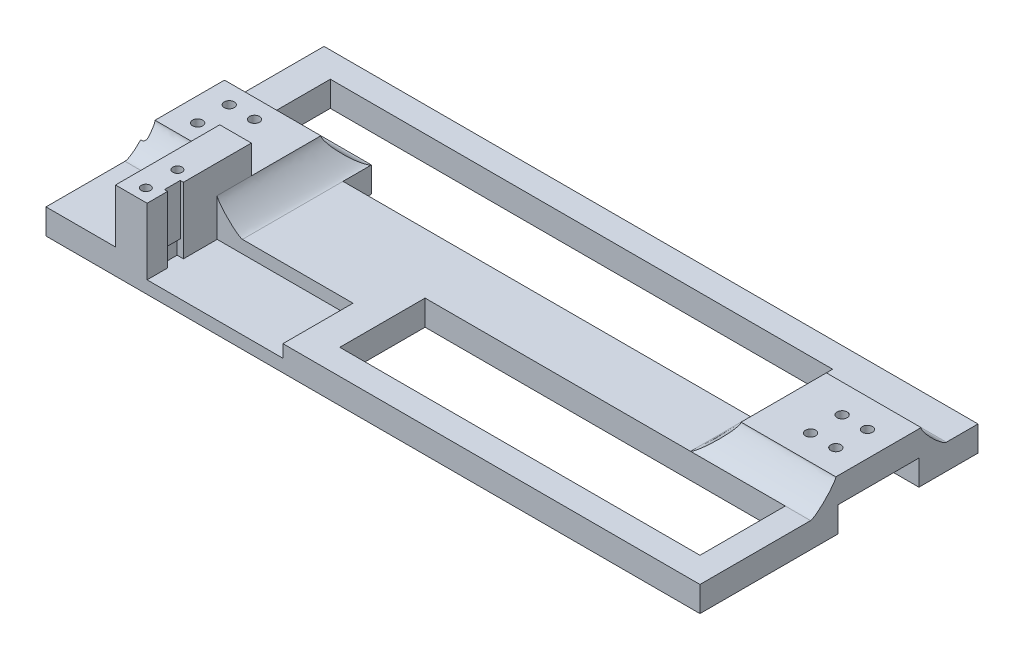
from build123d import *

# Parameters (mm, degrees)
SKETCH1_W            = 300
SKETCH1_H            = 20
BOSS_EXTRUDE1_DEPTH  = 8
SKETCH2_W            = 34
SKETCH2_H            = 8
BOSS_EXTRUDE2_DEPTH  = 9
SKETCH3_W            = 34
SKETCH3_H            = 8
BOSS_EXTRUDE3_DEPTH  = 9
SKETCH4_R            = 1.45
CUT_EXTRUDE1_DEPTH   = 302.504560496
SKETCH5_W            = 25
SKETCH5_H            = 8
BOSS_EXTRUDE4_DEPTH  = 17
SKETCH6_W            = 25
SKETCH6_H            = 8
BOSS_EXTRUDE5_DEPTH  = 17
SKETCH7_W            = 10
SKETCH7_H            = 38
CUT_EXTRUDE2_DEPTH   = 303.37890138
SKETCH8_W            = 7
SKETCH8_H            = 16
CUT_EXTRUDE3_DEPTH   = 4
CUT_EXTRUDE4_DEPTH   = 7
BOSS_EXTRUDE6_DEPTH  = 10
SKETCH12_W           = 8
SKETCH12_H           = 8
BOSS_EXTRUDE7_DEPTH  = 17
SKETCH13_R           = 1.7
CUT_EXTRUDE6_DEPTH   = 305.926220585
SKETCH14_W           = 20
SKETCH14_H           = 13
BOSS_EXTRUDE8_DEPTH  = 12
SKETCH15_R           = 1.6
CUT_EXTRUDE7_DEPTH   = 20
SKETCH16_W           = 20
SKETCH16_H           = 13
BOSS_EXTRUDE9_DEPTH  = 12
SKETCH17_R           = 1.6
CUT_EXTRUDE8_DEPTH   = 20
SKETCH18_W           = 20
SKETCH18_H           = 13
BOSS_EXTRUDE10_DEPTH = 12
CUT_EXTRUDE9_START   = -20
SKETCH19_R           = 1.6
CUT_EXTRUDE9_DEPTH   = 20
SKETCH20_W           = 20
SKETCH20_H           = 13
BOSS_EXTRUDE11_DEPTH = 12
CUT_EXTRUDE10_START  = -20
SKETCH21_R           = 1.6
CUT_EXTRUDE10_DEPTH  = 20
FILLET6_R            = 3
SKETCH22_W           = 114.514593174
SKETCH22_H           = 38.01155773
CUT_EXTRUDE11_DEPTH  = 59
SKETCH23_W           = 255.474860827
SKETCH23_H           = 73.711598505
CUT_EXTRUDE12_DEPTH  = 36
SKETCH24_W           = 30
SKETCH24_H           = 20
BOSS_EXTRUDE12_DEPTH = 8
SKETCH25_W           = 20
SKETCH25_H           = 8
CUT_EXTRUDE13_DEPTH  = 243.357174435
SKETCH26_R           = 1.6
CUT_EXTRUDE14_DEPTH  = 242.960740617
SKETCH27_W           = 30
SKETCH27_H           = 8
BOSS_EXTRUDE13_DEPTH = 15
SKETCH28_W           = 30
SKETCH28_H           = 26
BOSS_EXTRUDE14_DEPTH = 8
SKETCH29_W           = 21
SKETCH29_H           = 8
CUT_EXTRUDE17_DEPTH  = 25
SKETCH30_R           = 1.6
CUT_EXTRUDE18_DEPTH  = 242.960740617
SKETCH31_W           = 10
SKETCH31_H           = 8
BOSS_EXTRUDE15_DEPTH = 34
SKETCH32_W           = 10
SKETCH32_H           = 34
BOSS_EXTRUDE16_DEPTH = 17
SKETCH33_R           = 1.45
CUT_EXTRUDE19_DEPTH  = 249.237789226
SKETCH34_W           = 175
SKETCH34_H           = 34
SKETCH34_W_2         = 155
BOSS_EXTRUDE17_DEPTH = 8
SKETCH35_W           = 19
SKETCH35_H           = 8
BOSS_EXTRUDE23_DEPTH = 8
SKETCH36_W           = 30
SKETCH36_H           = 8
BOSS_EXTRUDE24_DEPTH = 1
SKETCH37_W           = 19
SKETCH37_H           = 8
BOSS_EXTRUDE25_DEPTH = 22
SKETCH38_W           = 30
SKETCH38_H           = 8
BOSS_EXTRUDE26_DEPTH = 1
SKETCH39_W           = 20
SKETCH39_H           = 8
BOSS_EXTRUDE27_DEPTH = 1
SKETCH49_W           = 10
SKETCH49_H           = 9
CUT_EXTRUDE25_DEPTH  = 1
SKETCH40_W           = 33.7
SKETCH40_H           = 8
BOSS_EXTRUDE28_DEPTH = 20
SKETCH41_W           = 114.01162948
SKETCH41_H           = 27
SKETCH41_W_2         = 34.98837052
SKETCH41_H_2         = 14.181402085
CUT_EXTRUDE20_DEPTH  = 248.560093715
SKETCH42_W           = 42.98837052
SKETCH42_H           = 22.181402085
BOSS_EXTRUDE29_DEPTH = 4
FILLET13_SIZE        = 8
SKETCH43_W           = 5
SKETCH43_H           = 21
CUT_EXTRUDE21_DEPTH  = 1
SKETCH44_W           = 5
SKETCH44_H           = 5
CUT_EXTRUDE22_DEPTH  = 1
SKETCH45_W           = 21
SKETCH45_H           = 0.3
CUT_EXTRUDE23_DEPTH  = 8
BOSS_EXTRUDE31_DEPTH = 2
FILLET14_START       = 34
FILLET14_DEPTH       = 31.9999999
FILLET14_START_2     = -9.0000001
FILLET14_2_DEPTH     = 8.0000001
FILLET14_START_3     = 65.99999999
FILLET14_3_DEPTH     = 8.00000011
SKETCH48_W           = 28
SKETCH48_H           = 23.779662164
CUT_EXTRUDE24_DEPTH  = 1.5
FILLET15_R           = 1


with BuildPart() as part:
    # Sketch1 → Boss-Extrude1 (new body)
    with BuildSketch(Plane(origin=(0, 0, 0), x_dir=(1, 0, 0), z_dir=(0, 1, 0))):
        with Locations((150, -10)):
            Rectangle(SKETCH1_W, SKETCH1_H)
    extrude(amount=BOSS_EXTRUDE1_DEPTH)

    # Sketch2 → Boss-Extrude2 (add)
    with BuildSketch(Plane.XY.offset(20)):
        with Locations((17, 4)):
            Rectangle(SKETCH2_W, SKETCH2_H)
        with Locations((283, 4)):
            Rectangle(SKETCH2_W, SKETCH2_H)
    extrude(amount=BOSS_EXTRUDE2_DEPTH)

    # Sketch3 → Boss-Extrude3 (add)
    with BuildSketch(Plane(origin=(0, 0, 0), x_dir=(-1, 0, 0), z_dir=(0, 0, -1))):
        with Locations((-17, 4)):
            Rectangle(SKETCH3_W, SKETCH3_H)
        with Locations((-283, 4)):
            Rectangle(SKETCH3_W, SKETCH3_H)
    extrude(amount=BOSS_EXTRUDE3_DEPTH)

    # Sketch4 → Cut-Extrude1 (cut, through all)
    with BuildSketch(Plane(origin=(0, 8, 0), x_dir=(1, 0, 0), z_dir=(0, 1, 0))):
        with Locations(Location((4, 5, 0), (0, 0, 270))):
            Circle(SKETCH4_R)
        with Locations(Location((30, 5, 0), (0, 0, 270))):
            Circle(SKETCH4_R)
        with Locations(Location((30, -25, 0), (0, 0, 270))):
            Circle(SKETCH4_R)
        with Locations(Location((4, -25, 0), (0, 0, 270))):
            Circle(SKETCH4_R)
        with Locations(Location((296, -25, 0), (0, 0, 270))):
            Circle(SKETCH4_R)
        with Locations(Location((296, 5, 0), (0, 0, 270))):
            Circle(SKETCH4_R)
        with Locations(Location((270, -25, 0), (0, 0, 270))):
            Circle(SKETCH4_R)
        with Locations(Location((270, 5, 0), (0, 0, 270))):
            Circle(SKETCH4_R)
    extrude(amount=-CUT_EXTRUDE1_DEPTH, mode=Mode.SUBTRACT)

    # Sketch5 → Boss-Extrude4 (add)
    with BuildSketch(Plane.XY.offset(20)):
        with Locations((253.5, 4)):
            Rectangle(SKETCH5_W, SKETCH5_H)
    extrude(amount=BOSS_EXTRUDE4_DEPTH)

    # Sketch6 → Boss-Extrude5 (add)
    with BuildSketch(Plane(origin=(0, 0, 0), x_dir=(-1, 0, 0), z_dir=(0, 0, -1))):
        with Locations((-253.5, 4)):
            Rectangle(SKETCH6_W, SKETCH6_H)
    extrude(amount=BOSS_EXTRUDE5_DEPTH)

    # Sketch7 → Cut-Extrude2 (cut, through all)
    with BuildSketch(Plane(origin=(0, 8, 0), x_dir=(1, 0, 0), z_dir=(0, 1, 0))):
        with Locations((254, -10)):
            Rectangle(SKETCH7_W, SKETCH7_H)
    extrude(amount=-CUT_EXTRUDE2_DEPTH, mode=Mode.SUBTRACT)

    # Sketch8 → Cut-Extrude3 (cut)
    with BuildSketch(Plane(origin=(0, 8, 0), x_dir=(1, 0, 0), z_dir=(0, 1, 0))):
        with Locations((262.5, -10)):
            Rectangle(SKETCH8_W, SKETCH8_H)
    extrude(amount=-CUT_EXTRUDE3_DEPTH, mode=Mode.SUBTRACT)

    # Sketch9 → Cut-Extrude4 (cut)
    with BuildSketch(Plane.ZY.offset(-259)):
        Polygon((18, 4), (22, 8), (18, 8), align=None)
        Polygon((2, 4), (-2, 8), (2, 8), align=None)
    extrude(amount=-CUT_EXTRUDE4_DEPTH, mode=Mode.SUBTRACT)

    # Sketch10 → Boss-Extrude6 (add)
    with BuildSketch(Plane.ZY.offset(-259)):
        Polygon((-2, 0), (-9, 8), (-9, 0), align=None)
        Polygon((29, 8), (22, 0), (29, 0), align=None)
    extrude(amount=BOSS_EXTRUDE6_DEPTH)

    # Sketch12 → Boss-Extrude7 (add)
    with BuildSketch(Plane.XY.offset(37)):
        with Locations((245, 4)):
            Rectangle(SKETCH12_W, SKETCH12_H)
    extrude(amount=BOSS_EXTRUDE7_DEPTH)

    # Sketch13 → Cut-Extrude6 (cut, through all)
    with BuildSketch(Plane(origin=(0, 8, 0), x_dir=(1, 0, 0), z_dir=(0, 1, 0))):
        with Locations(Location((245, -50, 0), (0, 0, 270))):
            Circle(SKETCH13_R)
        with Locations(Location((245, -18, 0), (0, 0, 270))):
            Circle(SKETCH13_R)
    extrude(amount=-CUT_EXTRUDE6_DEPTH, mode=Mode.SUBTRACT)

    # Sketch14 → Boss-Extrude8 (add)
    with BuildSketch(Plane.XY.offset(29)):
        with Locations((285, 6.5)):
            Rectangle(SKETCH14_W, SKETCH14_H)
    extrude(amount=BOSS_EXTRUDE8_DEPTH)

    # Sketch15 → Cut-Extrude7 (cut)
    with BuildSketch(Plane(origin=(295, 0, 0), x_dir=(0, 0, -1), z_dir=(1, 0, 0))):
        with Locations((-35, 8)):
            Circle(SKETCH15_R)
    extrude(amount=-CUT_EXTRUDE7_DEPTH, mode=Mode.SUBTRACT)

    # Sketch16 → Boss-Extrude9 (add)
    with BuildSketch(Plane(origin=(0, 0, -9), x_dir=(-1, 0, 0), z_dir=(0, 0, -1))):
        with Locations((-285, 6.5)):
            Rectangle(SKETCH16_W, SKETCH16_H)
    extrude(amount=BOSS_EXTRUDE9_DEPTH)

    # Sketch17 → Cut-Extrude8 (cut)
    with BuildSketch(Plane(origin=(295, 0, 0), x_dir=(0, 0, -1), z_dir=(1, 0, 0))):
        with Locations((15, 8)):
            Circle(SKETCH17_R)
    extrude(amount=-CUT_EXTRUDE8_DEPTH, mode=Mode.SUBTRACT)

    # Sketch18 → Boss-Extrude10 (add)
    with BuildSketch(Plane(origin=(0, 0, -9), x_dir=(-1, 0, 0), z_dir=(0, 0, -1))):
        with Locations((-15, 6.5)):
            Rectangle(SKETCH18_W, SKETCH18_H)
    extrude(amount=BOSS_EXTRUDE10_DEPTH)

    # Sketch19 → Cut-Extrude9 (cut)
    with BuildSketch(Plane.ZY.offset(-5).offset(CUT_EXTRUDE9_START)):
        with Locations(Location((-15, 8, 0), (0, 0, 180))):
            Circle(SKETCH19_R)
    extrude(amount=CUT_EXTRUDE9_DEPTH, mode=Mode.SUBTRACT)

    # Sketch20 → Boss-Extrude11 (add)
    with BuildSketch(Plane.XY.offset(29)):
        with Locations((15, 6.5)):
            Rectangle(SKETCH20_W, SKETCH20_H)
    extrude(amount=BOSS_EXTRUDE11_DEPTH)

    # Sketch21 → Cut-Extrude10 (cut)
    with BuildSketch(Plane.ZY.offset(-5).offset(CUT_EXTRUDE10_START)):
        with Locations(Location((35, 8, 0), (0, 0, 180))):
            Circle(SKETCH21_R)
    extrude(amount=CUT_EXTRUDE10_DEPTH, mode=Mode.SUBTRACT)

    # Fillet6
    fillet6_edges = [part.edges().sort_by_distance(p)[0] for p in [
        (285, 13, 29),
        (285, 13, 41),
        (285, 13, -9),
        (285, 13, -21),
        (15, 13, -9),
        (15, 13, -21),
        (15, 13, 29),
        (15, 13, 41),
    ]]
    fillet(fillet6_edges, radius=FILLET6_R)

    # Sketch22 → Cut-Extrude11 (cut)
    with BuildSketch(Plane(origin=(300, 0, 0), x_dir=(0, 0, -1), z_dir=(1, 0, 0))):
        with Locations((-15.649926743, 3.068885872)):
            Rectangle(SKETCH22_W, SKETCH22_H)
    extrude(amount=-CUT_EXTRUDE11_DEPTH, mode=Mode.SUBTRACT)

    # Sketch23 → Cut-Extrude12 (cut)
    with BuildSketch(Plane.ZY):
        with Locations((-8.880898517, 0.160078518)):
            Rectangle(SKETCH23_W, SKETCH23_H)
    extrude(amount=-CUT_EXTRUDE12_DEPTH, mode=Mode.SUBTRACT)

    # Sketch24 → Boss-Extrude12 (add)
    with BuildSketch(Plane(origin=(0, 8, 0), x_dir=(1, 0, 0), z_dir=(0, 1, 0))):
        with Locations((51, -10)):
            Rectangle(SKETCH24_W, SKETCH24_H)
    extrude(amount=BOSS_EXTRUDE12_DEPTH)

    # Sketch25 → Cut-Extrude13 (cut, through all)
    with BuildSketch(Plane(origin=(0, 0, 0), x_dir=(-1, 0, 0), z_dir=(0, 0, -1))):
        with Locations((-46, 4)):
            Rectangle(SKETCH25_W, SKETCH25_H)
    extrude(amount=-CUT_EXTRUDE13_DEPTH, mode=Mode.SUBTRACT)

    # Sketch26 → Cut-Extrude14 (cut, through all)
    with BuildSketch(Plane(origin=(0, 8, 0), x_dir=(-1, 0, 0), z_dir=(0, -1, 0))):
        with Locations(Location((-51, -5, 0), (0, 0, 180))):
            Circle(SKETCH26_R)
        with Locations(Location((-51, -15, 0), (0, 0, 180))):
            Circle(SKETCH26_R)
        with Locations(Location((-43, -5, 0), (0, 0, 180))):
            Circle(SKETCH26_R)
        with Locations(Location((-43, -15, 0), (0, 0, 180))):
            Circle(SKETCH26_R)
    extrude(amount=-CUT_EXTRUDE14_DEPTH, mode=Mode.SUBTRACT)

    # Sketch27 → Boss-Extrude13 (add)
    with BuildSketch(Plane(origin=(0, 0, 0), x_dir=(-1, 0, 0), z_dir=(0, 0, -1))):
        with Locations((-226, 4)):
            Rectangle(SKETCH27_W, SKETCH27_H)
    extrude(amount=BOSS_EXTRUDE13_DEPTH)

    # Sketch28 → Boss-Extrude14 (add)
    with BuildSketch(Plane(origin=(0, 8, 0), x_dir=(1, 0, 0), z_dir=(0, 1, 0))):
        with Locations((226, 2)):
            Rectangle(SKETCH28_W, SKETCH28_H)
    extrude(amount=BOSS_EXTRUDE14_DEPTH)

    # Sketch29 → Cut-Extrude17 (cut)
    with BuildSketch(Plane(origin=(0, 0, -15), x_dir=(-1, 0, 0), z_dir=(0, 0, -1))):
        with Locations((-230.5, 4)):
            Rectangle(SKETCH29_W, SKETCH29_H)
    extrude(amount=-CUT_EXTRUDE17_DEPTH, mode=Mode.SUBTRACT)

    # Sketch30 → Cut-Extrude18 (cut, through all)
    with BuildSketch(Plane(origin=(0, 8, 0), x_dir=(-1, 0, 0), z_dir=(0, -1, 0))):
        with Locations(Location((-225, 7, 0), (0, 0, 90))):
            Circle(SKETCH30_R)
        with Locations(Location((-225, -3, 0), (0, 0, 90))):
            Circle(SKETCH30_R)
        with Locations(Location((-233, 7, 0), (0, 0, 90))):
            Circle(SKETCH30_R)
        with Locations(Location((-233, -3, 0), (0, 0, 90))):
            Circle(SKETCH30_R)
    extrude(amount=-CUT_EXTRUDE18_DEPTH, mode=Mode.SUBTRACT)

    # Sketch31 → Boss-Extrude15 (add)
    with BuildSketch(Plane.XY.offset(20)):
        with Locations((61, 4)):
            Rectangle(SKETCH31_W, SKETCH31_H)
    extrude(amount=BOSS_EXTRUDE15_DEPTH)

    # Sketch32 → Boss-Extrude16 (add)
    with BuildSketch(Plane(origin=(0, 8, 0), x_dir=(1, 0, 0), z_dir=(0, 1, 0))):
        with Locations((61, -37)):
            Rectangle(SKETCH32_W, SKETCH32_H)
    extrude(amount=BOSS_EXTRUDE16_DEPTH)

    # Sketch33 → Cut-Extrude19 (cut, through all)
    with BuildSketch(Plane(origin=(0, 25, 0), x_dir=(1, 0, 0), z_dir=(0, 1, 0))):
        with Locations(Location((61.6, -40, 0), (0, 0, 270))):
            Circle(SKETCH33_R)
        with Locations(Location((61.6, -50, 0), (0, 0, 270))):
            Circle(SKETCH33_R)
    extrude(amount=-CUT_EXTRUDE19_DEPTH, mode=Mode.SUBTRACT)

    # Sketch34 → Boss-Extrude17 (add)
    with BuildSketch(Plane(origin=(0, 0, 0), x_dir=(-1, 0, 0), z_dir=(0, -1, 0))):
        with Locations((-153.5, -37)):
            Rectangle(SKETCH34_W, SKETCH34_H)
        with Locations((-133.5, 17)):
            Rectangle(SKETCH34_W_2, SKETCH34_H)
    extrude(amount=-BOSS_EXTRUDE17_DEPTH)

    # Sketch35 → Boss-Extrude23 (add)
    with BuildSketch(Plane(origin=(211, 0, 0), x_dir=(0, 0, -1), z_dir=(1, 0, 0))):
        with Locations((24.5, 4)):
            Rectangle(SKETCH35_W, SKETCH35_H)
    extrude(amount=BOSS_EXTRUDE23_DEPTH)

    # Sketch36 → Boss-Extrude24 (add)
    with BuildSketch(Plane(origin=(0, 0, -15), x_dir=(-1, 0, 0), z_dir=(0, 0, -1))):
        with Locations((-226, 12)):
            Rectangle(SKETCH36_W, SKETCH36_H)
    extrude(amount=BOSS_EXTRUDE24_DEPTH)

    # Sketch37 → Boss-Extrude25 (add)
    with BuildSketch(Plane(origin=(219, 0, 0), x_dir=(0, 0, -1), z_dir=(1, 0, 0))):
        with Locations((24.5, 4)):
            Rectangle(SKETCH37_W, SKETCH37_H)
    extrude(amount=BOSS_EXTRUDE25_DEPTH)

    # Sketch38 → Boss-Extrude26 (add)
    with BuildSketch(Plane(origin=(0, 0, 0), x_dir=(-1, 0, 0), z_dir=(0, 0, -1))):
        with Locations((-51, 12)):
            Rectangle(SKETCH38_W, SKETCH38_H)
    extrude(amount=BOSS_EXTRUDE26_DEPTH)

    # Sketch39 → Boss-Extrude27 (add)
    with BuildSketch(Plane.XY.offset(20)):
        with Locations((46, 12)):
            Rectangle(SKETCH39_W, SKETCH39_H)
    extrude(amount=BOSS_EXTRUDE27_DEPTH)

    # Sketch49 → Cut-Extrude25 (cut)
    with BuildSketch(Plane(origin=(0, 0, 20), x_dir=(-1, 0, 0), z_dir=(0, 0, -1))):
        with Locations((-61, 20.5)):
            Rectangle(SKETCH49_W, SKETCH49_H)
    extrude(amount=-CUT_EXTRUDE25_DEPTH, mode=Mode.SUBTRACT)

    # Sketch40 → Boss-Extrude28 (add)
    with BuildSketch(Plane.ZY.offset(-56)):
        with Locations((-17.15, 4)):
            Rectangle(SKETCH40_W, SKETCH40_H)
        with Locations((37.15, 4)):
            Rectangle(SKETCH40_W, SKETCH40_H)
    extrude(amount=BOSS_EXTRUDE28_DEPTH)

    # Sketch41 → Cut-Extrude20 (cut, through all)
    with BuildSketch(Plane(origin=(0, 8, 0), x_dir=(1, 0, 0), z_dir=(0, 1, 0))):
        with Locations((175.99418526, -32.5)):
            Rectangle(SKETCH41_W, SKETCH41_H)
        Polygon((44, 9), (74, 9), (74, 0), (203, 0), (203, 26), (44, 26), align=None)
        with Locations((91.49418526, -38.909298957)):
            Rectangle(SKETCH41_W_2, SKETCH41_H_2)
        Polygon((108.98837052, -54), (108.98837052, -46), (74, -46), (74, -31.818597915), (66, -31.818597915), (66, -54), align=None)
    extrude(amount=-CUT_EXTRUDE20_DEPTH, mode=Mode.SUBTRACT)

    # Sketch42 → Boss-Extrude29 (add)
    with BuildSketch(Plane(origin=(0, 0, 0), x_dir=(-1, 0, 0), z_dir=(0, -1, 0))):
        with Locations((-87.49418526, -42.909298957)):
            Rectangle(SKETCH42_W, SKETCH42_H)
    extrude(amount=-BOSS_EXTRUDE29_DEPTH)

    # Fillet13
    # a fillet whose section is not a circle: 8 mm, written as the material it adds along each edge
    with BuildSketch(Plane(origin=(66, 8, -1), x_dir=(1, 0, 0), z_dir=(0, 0, 1))) as fillet13_piece_1:
        with BuildLine():
            Bezier((FILLET13_SIZE, 0), (0, 0), (0, FILLET13_SIZE), weights=[1, 0.176470588, 1])
            Line((0, FILLET13_SIZE), (0, 0))
            Line((0, 0), (FILLET13_SIZE, 0))
        make_face()
    extrude(amount=32.818597915)
    with BuildSketch(Plane(origin=(211, 8, -16), x_dir=(0, 0, -1), z_dir=(1, 0, 0))) as fillet13_piece_2:
        with BuildLine():
            Bezier((FILLET13_SIZE, 0), (0, 0), (0, FILLET13_SIZE), weights=[1, 0.176470588, 1])
            Line((0, FILLET13_SIZE), (0, 0))
            Line((0, 0), (FILLET13_SIZE, 0))
        make_face()
    extrude(amount=30)
    with BuildSketch(Plane(origin=(211, 8, 11), x_dir=(0, 0, 1), z_dir=(1, 0, 0))) as fillet13_piece_3:
        with BuildLine():
            Bezier((FILLET13_SIZE, 0), (0, 0), (0, -FILLET13_SIZE), weights=[1, 0.176470588, 1])
            Line((0, -FILLET13_SIZE), (0, 0))
            Line((0, 0), (FILLET13_SIZE, 0))
        make_face()
    extrude(amount=30)
    with BuildSketch(Plane(origin=(211, 8, 11), x_dir=(-1, 0, 0), z_dir=(0, 0, -1))) as fillet13_piece_4:
        with BuildLine():
            Bezier((FILLET13_SIZE, 0), (0, 0), (0, FILLET13_SIZE), weights=[1, 0.176470588, 1])
            Line((0, FILLET13_SIZE), (0, 0))
            Line((0, 0), (FILLET13_SIZE, 0))
        make_face()
    extrude(amount=27)
    with BuildSketch(Plane(origin=(211, 8, 11), x_dir=(-1, 0, 0), z_dir=(0, 0, -1))) as fillet13_piece_5a_section:
        with BuildLine():
            Bezier((FILLET13_SIZE, 0), (0, 0), (0, FILLET13_SIZE), weights=[1, 0.176470588, 1])
            Line((0, FILLET13_SIZE), (0, 0))
            Line((0, 0), (FILLET13_SIZE, 0))
        make_face()
    fillet13_piece_5a = extrude(amount=47, mode=Mode.PRIVATE)
    fillet13_piece_5a = split(fillet13_piece_5a, bisect_by=Plane(origin=(211, 8, -26), z_dir=(0, 0, 1)), keep=Keep.TOP, mode=Mode.PRIVATE)
    fillet13_piece_5a = split(fillet13_piece_5a, bisect_by=Plane(origin=(211, 8, -16), z_dir=(0, 0, -1)), keep=Keep.TOP, mode=Mode.PRIVATE)
    with BuildSketch(Plane(origin=(191, 8, -16), x_dir=(0, 0, -1), z_dir=(1, 0, 0))) as fillet13_piece_5b_section:
        with BuildLine():
            Bezier((FILLET13_SIZE, 0), (0, 0), (0, FILLET13_SIZE), weights=[1, 0.176470588, 1])
            Line((0, FILLET13_SIZE), (0, 0))
            Line((0, 0), (FILLET13_SIZE, 0))
        make_face()
    fillet13_piece_5b = extrude(amount=50, mode=Mode.PRIVATE)
    fillet13_piece_5b = split(fillet13_piece_5b, bisect_by=Plane(origin=(203, 8, -16), z_dir=(1, 0, 0)), keep=Keep.TOP, mode=Mode.PRIVATE)
    fillet13_piece_5b = split(fillet13_piece_5b, bisect_by=Plane(origin=(211, 8, -16), z_dir=(-1, 0, 0)), keep=Keep.TOP, mode=Mode.PRIVATE)
    fillet13_piece_5 = fillet13_piece_5a & fillet13_piece_5b
    add(fillet13_piece_5)
    with BuildSketch(Plane(origin=(191, 8, 11), x_dir=(0, 0, 1), z_dir=(1, 0, 0))) as fillet13_piece_6a_section:
        with BuildLine():
            Bezier((FILLET13_SIZE, 0), (0, 0), (0, -FILLET13_SIZE), weights=[1, 0.176470588, 1])
            Line((0, -FILLET13_SIZE), (0, 0))
            Line((0, 0), (FILLET13_SIZE, 0))
        make_face()
    fillet13_piece_6a = extrude(amount=50, mode=Mode.PRIVATE)
    fillet13_piece_6a = split(fillet13_piece_6a, bisect_by=Plane(origin=(211, 8, 11), z_dir=(-1, 0, 0)), keep=Keep.TOP, mode=Mode.PRIVATE)
    with BuildSketch(Plane(origin=(211, 8, 31), x_dir=(-1, 0, 0), z_dir=(0, 0, -1))) as fillet13_piece_6b_section:
        with BuildLine():
            Bezier((FILLET13_SIZE, 0), (0, 0), (0, FILLET13_SIZE), weights=[1, 0.176470588, 1])
            Line((0, FILLET13_SIZE), (0, 0))
            Line((0, 0), (FILLET13_SIZE, 0))
        make_face()
    fillet13_piece_6b = extrude(amount=47, mode=Mode.PRIVATE)
    fillet13_piece_6b = split(fillet13_piece_6b, bisect_by=Plane(origin=(211, 8, 19), z_dir=(0, 0, -1)), keep=Keep.TOP, mode=Mode.PRIVATE)
    fillet13_piece_6b = split(fillet13_piece_6b, bisect_by=Plane(origin=(211, 8, 11), z_dir=(0, 0, 1)), keep=Keep.TOP, mode=Mode.PRIVATE)
    fillet13_piece_6 = fillet13_piece_6a & fillet13_piece_6b
    add(fillet13_piece_6)

    # Sketch43 → Cut-Extrude21 (cut)
    with BuildSketch(Plane(origin=(66, 0, 0), x_dir=(0, 0, -1), z_dir=(1, 0, 0))):
        with Locations((-45, 14.5)):
            Rectangle(SKETCH43_W, SKETCH43_H)
    extrude(amount=-CUT_EXTRUDE21_DEPTH, mode=Mode.SUBTRACT)

    # Sketch44 → Cut-Extrude22 (cut)
    with BuildSketch(Plane(origin=(65, 0, 0), x_dir=(0, 0, -1), z_dir=(1, 0, 0))):
        with Locations((-45, 6.5)):
            Rectangle(SKETCH44_W, SKETCH44_H)
    extrude(amount=-CUT_EXTRUDE22_DEPTH, mode=Mode.SUBTRACT)

    # Sketch45 → Cut-Extrude23 (cut)
    with BuildSketch(Plane(origin=(0, 0, 0), x_dir=(-1, 0, 0), z_dir=(0, -1, 0))):
        with Locations((-230.5, 15.15)):
            Rectangle(SKETCH45_W, SKETCH45_H)
        with Locations((-230.5, -10.15)):
            Rectangle(SKETCH45_W, SKETCH45_H)
    extrude(amount=-CUT_EXTRUDE23_DEPTH, mode=Mode.SUBTRACT)

    # Sketch47 → Boss-Extrude31 (add)
    with BuildSketch(Plane.ZY.offset(-36)):
        Polygon((20.3, 8), (20.3, 0), (54, 0), (54, 8), (21, 8), (21, 16), (-1, 16), (-1, 8), (-34, 8), (-34, 0), (-0.3, 0), (-0.3, 8), align=None)
    extrude(amount=BOSS_EXTRUDE31_DEPTH)

    # Fillet14: read off the stored shape, not the designer's step
    # Fillet14 outline → Fillet14 (add)
    with BuildSketch(Plane.YZ.offset(FILLET14_START)):
        with BuildLine():
            add(Edge.make_bspline(
                [(8, 29), (8, 21), (16, 21)],
                knots=[0, 0, 0, 1, 1, 1], degree=2, weights=[1, 0.25, 1]))
            Line((8, 29), (8, 21))
            Line((8, 21), (16, 21))
        make_face()
        with BuildLine():
            Line((8, -1), (8, -9))
            add(Edge.make_bspline(
                [(8, -9), (8, -1), (16, -1)],
                knots=[0, 0, 0, 1, 1, 1], degree=2, weights=[1, 0.25, 1]))
            Line((16, -1), (8, -1))
        make_face()
    extrude(amount=FILLET14_DEPTH)

    # Fillet14 2 outline → Fillet14 2 (add)
    with BuildSketch(Plane.XY.offset(FILLET14_START_2)):
        with BuildLine():
            add(Edge.make_bspline(
                [(66, 16), (66, 8), (74, 8)],
                knots=[0, 0, 0, 1, 1, 1], degree=2, weights=[1, 0.176470588, 1]))
            Line((66, 16), (65.9999999, 8))
            Line((65.9999999, 8), (74, 8))
        make_face()
    extrude(amount=FILLET14_2_DEPTH)

    # Fillet14 3 outline → Fillet14 3 (cut)
    with BuildSketch(Plane.YZ.offset(FILLET14_START_3)):
        with BuildLine():
            add(Edge.make_bspline(
                [(8, -9), (8, -1), (16, -1)],
                knots=[0, 0, 0, 1, 1, 1], degree=2, weights=[1, 0.25, 1]))
            Line((8, -9), (16, -9.0000001))
            Line((16, -9.0000001), (16, -1))
        make_face()
    extrude(amount=FILLET14_3_DEPTH, mode=Mode.SUBTRACT)

    # Sketch48 → Cut-Extrude24 (cut)
    with BuildSketch(Plane.ZY.offset(-34)):
        with Locations((10, 6.933054746)):
            Rectangle(SKETCH48_W, SKETCH48_H)
    extrude(amount=-CUT_EXTRUDE24_DEPTH, mode=Mode.SUBTRACT)

    # Fillet15
    fillet15_edges = [part.edges().sort_by_distance(p)[0] for p in [
        (35.5, 5.701266635, 24),
        (35.5, 5.701266635, -4),
    ]]
    fillet(fillet15_edges, radius=FILLET15_R)


solid = part.part
